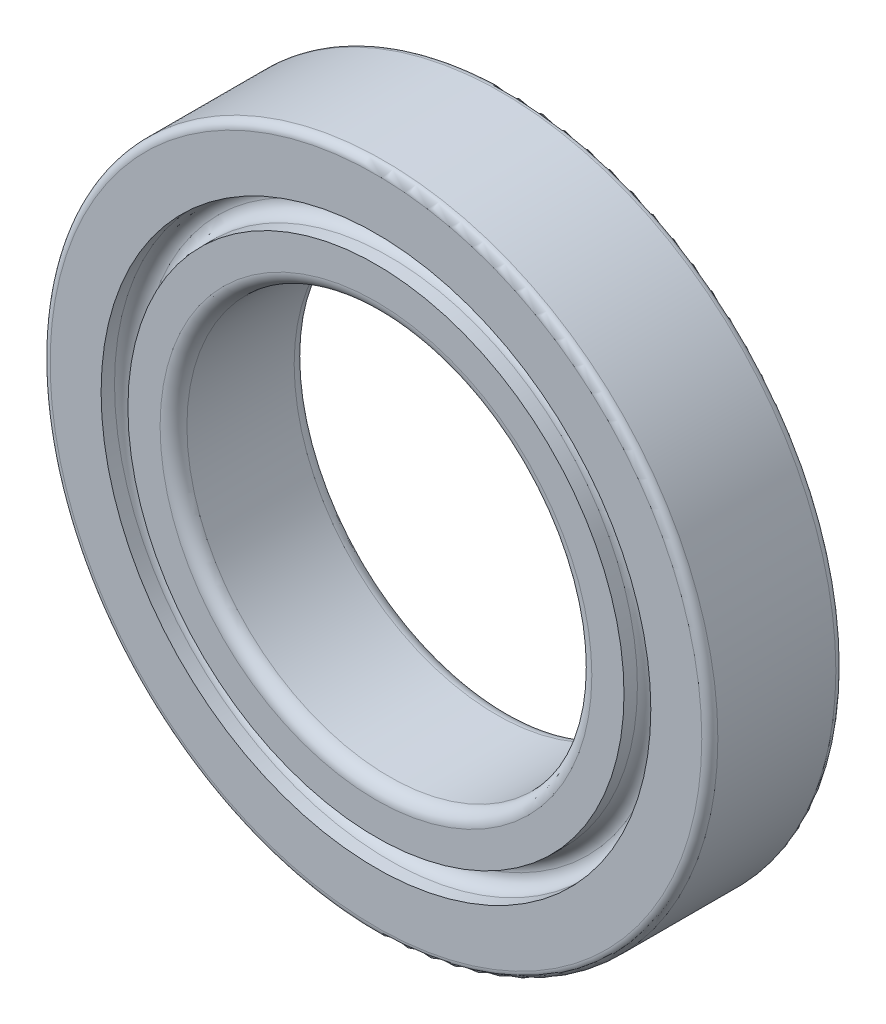
from build123d import *

# Parameters (mm, degrees)
SKETCH1_R           = 12.45
BOSS_EXTRUDE1_DEPTH = 5
SKETCH2_R           = 7.55
CUT_EXTRUDE1_DEPTH  = 19.303141807
FILLET1_R           = 0.5
SKETCH3_R           = 10.25
SKETCH3_R_2         = 9.25
CUT_EXTRUDE2_DEPTH  = 1
FILLET2_R           = 0.5
CUT_EXTRUDE3_START  = -1
SKETCH4_R           = 10.25
SKETCH4_R_2         = 9.25
CUT_EXTRUDE3_DEPTH  = 1
FILLET3_R           = 0.5
FILLET4_R           = 0.3


with BuildPart() as part:
    # Sketch1 → Boss-Extrude1 (new body)
    with BuildSketch(Plane.XY):
        Circle(SKETCH1_R)
    extrude(amount=BOSS_EXTRUDE1_DEPTH)

    # Sketch2 → Cut-Extrude1 (cut, through all)
    with BuildSketch(Plane.XY.offset(5)):
        Circle(SKETCH2_R)
    extrude(amount=-CUT_EXTRUDE1_DEPTH, mode=Mode.SUBTRACT)

    # Fillet1
    fillet1_edges = [part.edges().sort_by_distance(p)[0] for p in [
        (-7.55, 0, 0),
        (-7.55, 0, 5),
    ]]
    fillet(fillet1_edges, radius=FILLET1_R)

    # Sketch3 → Cut-Extrude2 (cut)
    with BuildSketch(Plane.XY.offset(5)):
        Circle(SKETCH3_R)
        Circle(SKETCH3_R_2, mode=Mode.SUBTRACT)
    extrude(amount=-CUT_EXTRUDE2_DEPTH, mode=Mode.SUBTRACT)

    # Fillet2
    fillet2_edges = [part.edges().sort_by_distance(p)[0] for p in [
        (-10.25, 0, 4),
        (-9.25, 0, 4),
    ]]
    fillet(fillet2_edges, radius=FILLET2_R - 0.0001)  # a hair under: the kernel refuses the full size

    # Sketch4 → Cut-Extrude3 (cut)
    with BuildSketch(Plane(origin=(0, 0, 0), x_dir=(-1, 0, 0), z_dir=(0, 0, -1)).offset(CUT_EXTRUDE3_START)):
        with Locations(Location((0, 0, 0), (0, 0, 180))):
            Circle(SKETCH4_R)
        with Locations(Location((0, 0, 0), (0, 0, 180))):
            Circle(SKETCH4_R_2, mode=Mode.SUBTRACT)
    extrude(amount=CUT_EXTRUDE3_DEPTH, mode=Mode.SUBTRACT)

    # Fillet3
    fillet3_edges = [part.edges().sort_by_distance(p)[0] for p in [
        (-10.25, 0, 1),
        (-9.25, 0, 1),
    ]]
    fillet(fillet3_edges, radius=FILLET3_R - 0.0001)  # a hair under: the kernel refuses the full size

    # Fillet4
    fillet4_edges = [part.edges().sort_by_distance(p)[0] for p in [
        (-12.45, 0, 0),
        (-12.45, 0, 5),
    ]]
    fillet(fillet4_edges, radius=FILLET4_R)


solid = part.part
